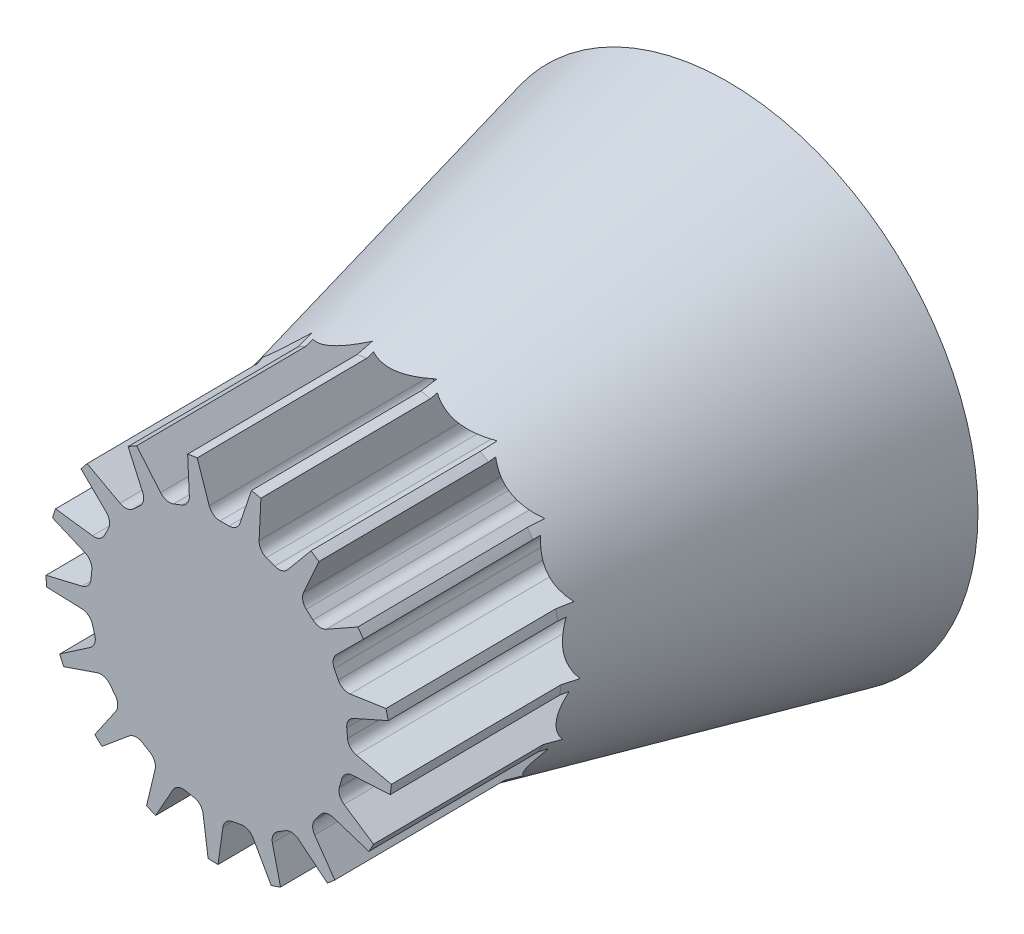
from build123d import *

# Parameters (mm, degrees)
BOSS_EXTRUDE10_OUTLINE_R = 9
BOSS_EXTRUDE10_DEPTH     = 7.87
BODY_MOVE_COPY9_ANGLE    = 90.5
SKETCH50_R               = 9.015
CUT_EXTRUDE19_DEPTH      = 4.9748
SKETCH53_R               = 11.15
BOSS_EXTRUDE11_DEPTH     = 15.15
SKETCH55_R               = 9.015
CUT_EXTRUDE28_DEPTH      = 9.91
SKETCH54_R               = 10
CUT_EXTRUDE29_DEPTH      = 3
SKETCH56_R               = 1.425
SKETCH56_R_2             = 1.427
CUT_EXTRUDE31_DEPTH      = 8.5
CHAMFER2_SIZE            = 15.16016556
CHAMFER2_SIZE_2          = 3.5
SKETCH58_R               = 7.65
BOSS_EXTRUDE12_DEPTH     = 7.62
CUT_EXTRUDE32_DEPTH      = 10


with BuildPart() as part:
    # Boss-Extrude10: read off the stored shape, not the designer's step
    # Boss-Extrude10 outline → Boss-Extrude10 (new body)
    with BuildSketch(Plane(origin=(0, 0, 0), x_dir=(0, 0, -1), z_dir=(1, 0, 0))):
        with Locations((65.441068567, -30.262394245)):
            Circle(BOSS_EXTRUDE10_OUTLINE_R)
    extrude(amount=BOSS_EXTRUDE10_DEPTH)


with BuildPart() as part_1:
    # Body-Move/Copy7: moved
    add(part.part.moved(Location((-2.71632086, 20.248937321, 0))))


with BuildPart() as part_2:
    # Body-Move/Copy8: moved
    add(part_1.part.moved(Location((-79.493576211, 0, 40.086791707))))


with BuildPart() as part_3:
    # Body-Move/Copy9: read off the stored shape, not the designer's step
    # Body-Move/Copy9: moved
    add(part_2.part.moved(Location((104.4191482, 0, -52.8033185))).rotate(Axis((0, 0, 0), (0, 1, 0)), BODY_MOVE_COPY9_ANGLE))

    # Sketch50 → Cut-Extrude19 (cut)
    with BuildSketch(Plane(origin=(-0.262487652, 0, -30.078105768), x_dir=(-0.999961923064164, 0, 0.008726535499214816), z_dir=(-0.008726535499214816, 0, -0.999961923064164))):
        with Locations((78.157595316, -10.013456924)):
            Circle(SKETCH50_R)
    extrude(amount=-CUT_EXTRUDE19_DEPTH, mode=Mode.SUBTRACT)

    # Sketch55 → Cut-Extrude28 (cut)
    with BuildSketch(Plane(origin=(-0.193809818, 0, -22.208405433), x_dir=(0.999961923064164, 0, -0.008726535499214816), z_dir=(0.008726535499214816, 0, 0.999961923064164))):
        with Locations((-78.157595316, -10.013456924)):
            Circle(SKETCH55_R)
    extrude(amount=-CUT_EXTRUDE28_DEPTH, mode=Mode.SUBTRACT)


with BuildPart() as body_2:
    # Sketch53 → Boss-Extrude11 (new body)
    with BuildSketch(Plane(origin=(-0.262487652, 0, -30.078105768), x_dir=(-0.999961923064164, 0, 0.008726535499214816), z_dir=(-0.008726535499214816, 0, -0.999961923064164))):
        with Locations(Location((78.157595316, -10.013456924, 0), (0, 0, 180))):
            Circle(SKETCH53_R)
    extrude(amount=BOSS_EXTRUDE11_DEPTH)

    # Sketch54 → Cut-Extrude29 (cut)
    with BuildSketch(Plane(origin=(-0.394694665, 0, -45.227528902), x_dir=(-0.999961923064164, 0, 0.008726535499214816), z_dir=(-0.008726535499214816, 0, -0.999961923064164))):
        with Locations((78.157595316, -10.013456924)):
            Circle(SKETCH54_R)
    extrude(amount=-CUT_EXTRUDE29_DEPTH, mode=Mode.SUBTRACT)

    # Sketch56 → Cut-Extrude31 (cut)
    with BuildSketch(Plane(origin=(-0.368515059, 0, -42.227643133), x_dir=(-0.999961923064164, 0, 0.008726535499214816), z_dir=(-0.008726535499214816, 0, -0.999961923064164))):
        with Locations((71.166245316, -10.013456924)):
            Circle(SKETCH56_R)
        with Locations((78.157595316, -3.022106924)):
            Circle(SKETCH56_R_2)
        with Locations((85.148945316, -10.013456924)):
            Circle(SKETCH56_R)
        with Locations((78.157595316, -17.004806924)):
            Circle(SKETCH56_R)
    extrude(amount=-CUT_EXTRUDE31_DEPTH, mode=Mode.SUBTRACT)

    # Chamfer2
    # the kernel refuses this chamfer: 15.16016556, 3.5 mm, written as the material it takes off along each edge
    with BuildSketch(Plane(origin=(-78.417106967, -10.013456924, -29.396060738), x_dir=(0.999961923064164, 0, -0.008726535499214764), z_dir=(0, 1, 0))) as chamfer2_piece_1:
        Polygon((11.15, CHAMFER2_SIZE), (11.15 - CHAMFER2_SIZE_2, 0), (11.15, 0), align=None)
    revolve(axis=Axis((-78.417106967, -10.013456924, -29.396060738), (-0.008726535499214816, 0, -0.999961923064164)), mode=Mode.SUBTRACT)

    # Sketch58 → Boss-Extrude12 (add)
    with BuildSketch(Plane(origin=(-0.262487652, 0, -30.078105768), x_dir=(0.999961923064164, 0, -0.008726535499214816), z_dir=(0.008726535499214816, 0, 0.999961923064164))):
        with Locations(Location((-78.157595316, -10.013456924, 0), (0, 0, 180))):
            Circle(SKETCH58_R)
    extrude(amount=BOSS_EXTRUDE12_DEPTH)

    # Sketch59 → Cut-Extrude32 (cut)
    with BuildSketch(Plane(origin=(-0.195991452, 0, -22.458395914), x_dir=(0.999961923064164, 0, -0.008726535499214816), z_dir=(0.008726535499214816, 0, 0.999961923064164))):
        with BuildLine():
            Line((-81.387874001, -17.073412953), (-83.485200132, -15.774803592))
            Line((-83.485200132, -15.774803592), (-82.140347963, -14.654301277))
            ThreePointArc((-82.140347963, -14.654301277), (-81.85076378, -14.537835855), (-81.547742345, -14.612677042))
            Line((-81.547742345, -14.612677042), (-81.211180222, -14.821067486))
            ThreePointArc((-81.211180222, -14.821067486), (-81.009116862, -15.058961564), (-80.984293655, -15.370099799))
            Line((-80.984293655, -15.370099799), (-81.387874001, -17.073412953))
        make_face()
        with BuildLine():
            Line((-78.62678098, -17.759242005), (-81.051591163, -17.305966425))
            Line((-81.051591163, -17.305966425), (-80.202325986, -15.775312494))
            ThreePointArc((-80.202325986, -15.775312494), (-79.97436894, -15.56210185), (-79.664774112, -15.522425211))
            Line((-79.664774112, -15.522425211), (-79.275659968, -15.59516325))
            ThreePointArc((-79.275659968, -15.59516325), (-79.001304243, -15.743999167), (-78.865761197, -16.025159754))
            Line((-78.865761197, -16.025159754), (-78.62678098, -17.759242005))
        make_face()
        with BuildLine():
            Line((-83.222812421, -7.447699819), (-83.046364969, -7.093345566))
            ThreePointArc((-83.046364969, -7.093345566), (-82.999802332, -6.784711293), (-83.14249039, -6.507108499))
            Line((-83.14249039, -6.507108499), (-84.382300144, -5.271380143))
            Line((-84.382300144, -5.271380143), (-85.481853025, -7.479580005))
            Line((-85.481853025, -7.479580005), (-83.748568208, -7.724276838))
            ThreePointArc((-83.748568208, -7.724276838), (-83.44104763, -7.670851308), (-83.222812421, -7.447699819))
        make_face()
        with BuildLine():
            Line((-73.423479939, -6.215547398), (-71.895634674, -5.361239701))
            Line((-71.895634674, -5.361239701), (-73.718630998, -3.699358967))
            Line((-73.718630998, -3.699358967), (-74.428322592, -5.299512283))
            ThreePointArc((-74.428322592, -5.299512283), (-74.461093548, -5.609914052), (-74.306183623, -5.880886576))
            Line((-74.306183623, -5.880886576), (-74.013643754, -6.147571904))
            ThreePointArc((-74.013643754, -6.147571904), (-73.729533866, -6.27681882), (-73.423479939, -6.215547398))
        make_face()
        with BuildLine():
            Line((-70.615517979, -8.352694887), (-70.387909251, -10.808984251))
            Line((-70.387909251, -10.808984251), (-72.092543899, -10.411022557))
            ThreePointArc((-72.092543899, -10.411022557), (-72.359998771, -10.250115487), (-72.482885427, -9.96319727))
            Line((-72.482885427, -9.96319727), (-72.519410255, -9.569031599))
            ThreePointArc((-72.519410255, -9.569031599), (-72.451337062, -9.264418346), (-72.218002714, -9.057106321))
            Line((-72.218002714, -9.057106321), (-70.615517979, -8.352694887))
        make_face()
        with BuildLine():
            Line((-72.365876805, -8.188887445), (-70.632591989, -7.944190612))
            Line((-70.632591989, -7.944190612), (-71.73214487, -5.735990749))
            Line((-71.73214487, -5.735990749), (-72.971954623, -6.971719106))
            ThreePointArc((-72.971954623, -6.971719106), (-73.114642681, -7.2493219), (-73.068080044, -7.557956173))
            Line((-73.068080044, -7.557956173), (-72.891632592, -7.912310425))
            ThreePointArc((-72.891632592, -7.912310425), (-72.673397383, -8.135461915), (-72.365876805, -8.188887445))
        make_face()
        with BuildLine():
            Line((-76.066508243, -4.764320349), (-75.697385087, -4.907319422))
            ThreePointArc((-75.697385087, -4.907319422), (-75.385771135, -4.925206253), (-75.122518138, -4.757512922))
            Line((-75.122518138, -4.757512922), (-74.006456393, -3.408973351))
            Line((-74.006456393, -3.408973351), (-76.306690405, -2.517857947))
            Line((-76.306690405, -2.517857947), (-76.390416058, -4.266326651))
            ThreePointArc((-76.390416058, -4.266326651), (-76.308844012, -4.567605915), (-76.066508243, -4.764320349))
        make_face()
        with BuildLine():
            Line((-82.538750819, -5.86588366), (-84.066596084, -5.011575964))
            Line((-84.066596084, -5.011575964), (-82.24359976, -3.34969523))
            Line((-82.24359976, -3.34969523), (-81.533908166, -4.949848546))
            ThreePointArc((-81.533908166, -4.949848546), (-81.50113721, -5.260250315), (-81.656047135, -5.531222838))
            Line((-81.656047135, -5.531222838), (-81.948587005, -5.797908167))
            ThreePointArc((-81.948587005, -5.797908167), (-82.232696892, -5.927155083), (-82.538750819, -5.86588366))
        make_face()
        with BuildLine():
            Line((-73.935443635, -14.408161924), (-72.943808489, -15.850664101))
            Line((-72.943808489, -15.850664101), (-71.457221925, -13.882105349))
            Line((-71.457221925, -13.882105349), (-73.116031349, -13.323084695))
            ThreePointArc((-73.116031349, -13.323084695), (-73.42813272, -13.319093797), (-73.683656038, -13.498345093))
            Line((-73.683656038, -13.498345093), (-73.92221156, -13.814243657))
            ThreePointArc((-73.92221156, -13.814243657), (-74.024692779, -14.109066983), (-73.935443635, -14.408161924))
        make_face()
        with BuildLine():
            Line((-82.723131389, -13.993972388), (-83.714766536, -15.436474565))
            Line((-83.714766536, -15.436474565), (-85.2013531, -13.467915813))
            Line((-85.2013531, -13.467915813), (-83.542543676, -12.908895159))
            ThreePointArc((-83.542543676, -12.908895159), (-83.230442305, -12.904904261), (-82.974918987, -13.084155557))
            Line((-82.974918987, -13.084155557), (-82.736363465, -13.400054121))
            ThreePointArc((-82.736363465, -13.400054121), (-82.633882246, -13.694877447), (-82.723131389, -13.993972388))
        make_face()
        with BuildLine():
            Line((-83.645225248, -11.524038885), (-83.753555923, -11.143296053))
            ThreePointArc((-83.753555923, -11.143296053), (-83.927071285, -10.883843528), (-84.219538825, -10.77482091))
            Line((-84.219538825, -10.77482091), (-85.968274099, -10.696861065))
            Line((-85.968274099, -10.696861065), (-85.293198855, -13.069504441))
            Line((-85.293198855, -13.069504441), (-83.847434729, -12.082631152))
            ThreePointArc((-83.847434729, -12.082631152), (-83.656166827, -11.835973935), (-83.645225248, -11.524038885))
        make_face()
        with BuildLine():
            Line((-72.640396346, -12.581841073), (-71.19463222, -13.568714362))
            Line((-71.19463222, -13.568714362), (-70.519556976, -11.196070986))
            Line((-70.519556976, -11.196070986), (-72.26829225, -11.274030831))
            ThreePointArc((-72.26829225, -11.274030831), (-72.56075979, -11.383053448), (-72.734275151, -11.642505974))
            Line((-72.734275151, -11.642505974), (-72.842605827, -12.023248806))
            ThreePointArc((-72.842605827, -12.023248806), (-72.831664248, -12.335183856), (-72.640396346, -12.581841073))
        make_face()
        with BuildLine():
            Line((-84.079901463, -8.540297082), (-85.682386199, -7.835885647))
            Line((-85.682386199, -7.835885647), (-85.909994927, -10.292175011))
            Line((-85.909994927, -10.292175011), (-84.205360279, -9.894213318))
            ThreePointArc((-84.205360279, -9.894213318), (-83.937905407, -9.733306248), (-83.815018751, -9.446388031))
            Line((-83.815018751, -9.446388031), (-83.778493923, -9.052222359))
            ThreePointArc((-83.778493923, -9.052222359), (-83.846567116, -8.747609106), (-84.079901463, -8.540297082))
        make_face()
        with BuildLine():
            Line((-73.301875979, -16.048034151), (-75.39920211, -17.346643512))
            Line((-75.39920211, -17.346643512), (-75.802782456, -15.643330359))
            ThreePointArc((-75.802782456, -15.643330359), (-75.777959249, -15.332192123), (-75.575895889, -15.094298045))
            Line((-75.575895889, -15.094298045), (-75.239333766, -14.885907601))
            ThreePointArc((-75.239333766, -14.885907601), (-74.936312331, -14.811066414), (-74.646728148, -14.927531836))
            Line((-74.646728148, -14.927531836), (-73.301875979, -16.048034151))
        make_face()
        with BuildLine():
            Line((-76.653653564, -15.870682776), (-75.804388387, -17.401336706))
            Line((-75.804388387, -17.401336706), (-78.229198569, -17.854612286))
            Line((-78.229198569, -17.854612286), (-77.990218353, -16.120530036))
            ThreePointArc((-77.990218353, -16.120530036), (-77.854675306, -15.839369448), (-77.580319582, -15.690533532))
            Line((-77.580319582, -15.690533532), (-77.191205438, -15.617795492))
            ThreePointArc((-77.191205438, -15.617795492), (-76.881610609, -15.657472132), (-76.653653564, -15.870682776))
        make_face()
        with BuildLine():
            Line((-79.146791328, -2.35105595), (-76.679978977, -2.35105595))
            Line((-76.679978977, -2.35105595), (-77.233526879, -4.011699655))
            ThreePointArc((-77.233526879, -4.011699655), (-77.41842517, -4.26316698), (-77.715457994, -4.35905595))
            Line((-77.715457994, -4.35905595), (-78.111312311, -4.35905595))
            ThreePointArc((-78.111312311, -4.35905595), (-78.408345135, -4.26316698), (-78.593243426, -4.011699655))
            Line((-78.593243426, -4.011699655), (-79.146791328, -2.35105595))
        make_face()
        with BuildLine():
            Line((-80.739300653, -4.57002008), (-81.855362398, -3.221480509))
            Line((-81.855362398, -3.221480509), (-79.555128386, -2.330365105))
            Line((-79.555128386, -2.330365105), (-79.471402733, -4.078833809))
            ThreePointArc((-79.471402733, -4.078833809), (-79.552974779, -4.380113073), (-79.795310548, -4.576827507))
            Line((-79.795310548, -4.576827507), (-80.164433705, -4.71982658))
            ThreePointArc((-80.164433705, -4.71982658), (-80.476047656, -4.737713411), (-80.739300653, -4.57002008))
        make_face()
    extrude(amount=-CUT_EXTRUDE32_DEPTH, mode=Mode.SUBTRACT)


solid = body_2.part
